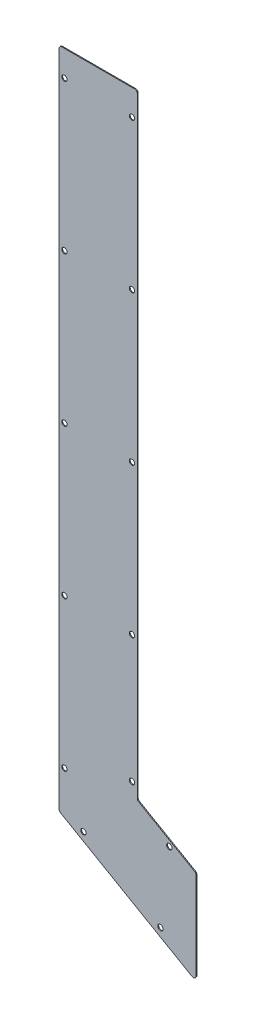
from build123d import *

# Parameters (mm, degrees)
BASE_FLANGE1_DEPTH = 1
SKETCH2_R          = 3
CUT_EXTRUDE1_DEPTH = 10
FILLET1_R          = 3


# Sheet-metal steps are written as plain solids
with BuildPart() as part:
    # Sketch1 → Base-Flange1 (new body)
    with BuildSketch(Plane.XY):
        Polygon((104, 853), (16, 853), (16, 107.151941455), (170, 18.24), (170, 123.634882233), (104, 161.74), align=None)
    extrude(amount=-BASE_FLANGE1_DEPTH)

    # Sketch2 → Cut-Extrude1 (cut)
    with BuildSketch(Plane(origin=(0, 0, -1), x_dir=(-1, 0, 0), z_dir=(0, 0, -1))):
        with Locations((-22, 824)):
            Circle(SKETCH2_R)
        with Locations((-98, 824)):
            Circle(SKETCH2_R)
        with Locations((-98, 656)):
            Circle(SKETCH2_R)
        with Locations((-98, 488)):
            Circle(SKETCH2_R)
        with Locations((-98, 320)):
            Circle(SKETCH2_R)
        with Locations((-22, 656)):
            Circle(SKETCH2_R)
        with Locations((-22, 488)):
            Circle(SKETCH2_R)
        with Locations((-22, 320)):
            Circle(SKETCH2_R)
        with Locations((-22, 152)):
            Circle(SKETCH2_R)
        with Locations((-98, 177)):
            Circle(SKETCH2_R)
        with Locations((-140, 134.564882233)):
            Circle(SKETCH2_R)
        with Locations((-130, 50.734882233)):
            Circle(SKETCH2_R)
        with Locations((-43.397459622, 100.734882233)):
            Circle(SKETCH2_R)
    extrude(amount=-CUT_EXTRUDE1_DEPTH, mode=Mode.SUBTRACT)

    # Fillet1
    fillet1_edges = [part.edges().sort_by_distance(p)[0] for p in [
        (104, 161.74, -0.5),
        (170, 123.634882233, -0.5),
        (170, 18.24, -0.5),
        (16, 107.151941455, -0.5),
        (16, 853, -0.5),
        (104, 853, -0.5),
    ]]
    fillet(fillet1_edges, radius=FILLET1_R)


solid = part.part
